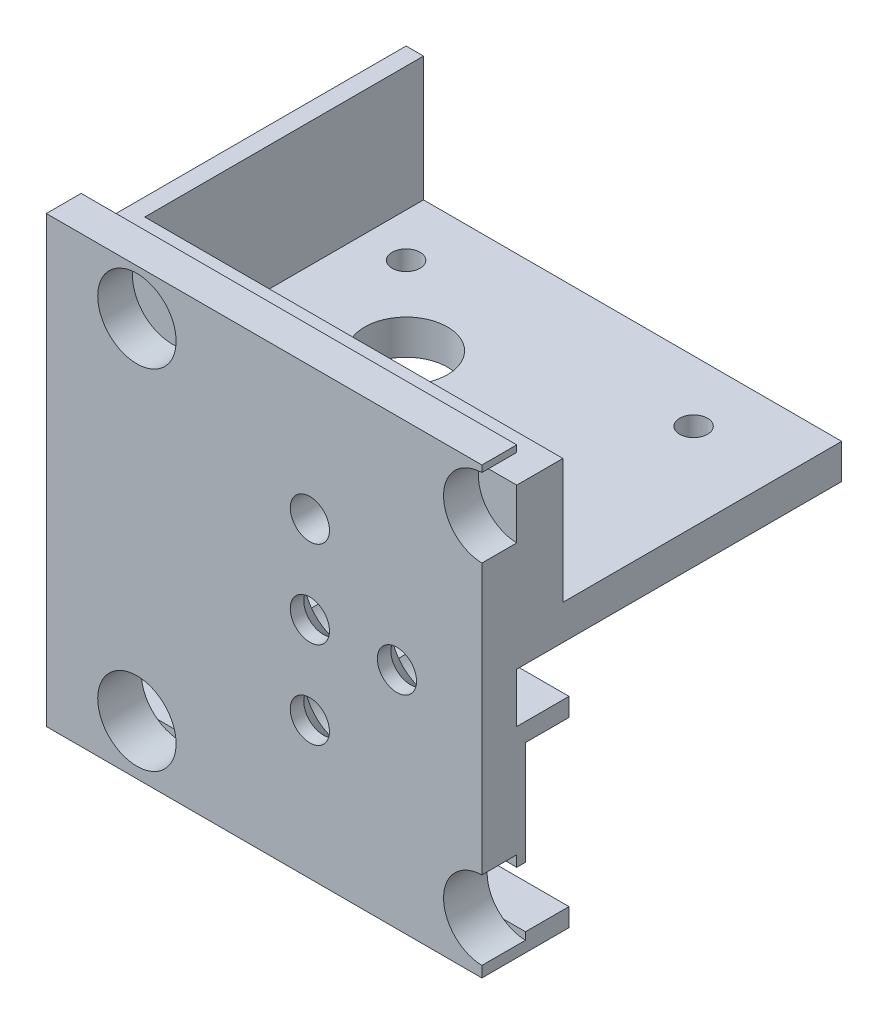
from build123d import *
from build123d.topology import SkipClean

# Parameters (mm, degrees)
BOSS_EXTRUDE1_START       = 0.5
SKETCH1_W                 = 25
SKETCH1_H                 = 14
BOSS_EXTRUDE1_DEPTH       = 2
SKETCH2_W                 = 25
SKETCH2_H                 = 2.1
BOSS_EXTRUDE2_DEPTH       = 6
SKETCH3_W                 = 50
SKETCH3_H                 = 42
BOSS_EXTRUDE3_DEPTH       = 4
BOSS_EXTRUDE5_START       = -18.3
SKETCH4_2_R               = 1.5
BOSS_EXTRUDE5_DEPTH       = 4
SKETCH5_W                 = 50
SKETCH5_H                 = 18.3
BOSS_EXTRUDE6_DEPTH       = 5.3
SKETCH24_W                = 50
SKETCH24_H                = 4
BOSS_EXTRUDE13_DEPTH      = 9
SKETCH7_R                 = 4.5
CUT_EXTRUDE1_DEPTH        = 4
SKETCH9_W                 = 35.343646405
SKETCH9_H                 = 8.813303651
CUT_EXTRUDE3_DEPTH        = 10
SKETCH11_R                = 12.5
SKETCH11_R_2              = 1.5
SKETCH11_R_3              = 3.55
BOSS_EXTRUDE7_DEPTH       = 4
SKETCH12_R                = 12.5
BOSS_EXTRUDE8_DEPTH       = 14
SKETCH13_W                = 25
SKETCH13_H                = 2.1
BOSS_EXTRUDE9_DEPTH       = 6
CUT_EXTRUDE2_DEPTH        = 64.84830294
SKETCH14_W                = 9.591087042
SKETCH14_H                = 22.957747356
CUT_EXTRUDE4_DEPTH        = 70.083614523
SKETCH15_W                = 33.975925545
SKETCH15_H                = 18.244219276
CUT_EXTRUDE5_DEPTH        = 62.391693358
SKETCH16_W                = 32
SKETCH16_H                = 4
BOSS_EXTRUDE10_DEPTH      = 50
SKETCH18_W                = 2
SKETCH18_H                = 14.3
BOSS_EXTRUDE11_DEPTH      = 32
CUT_EXTRUDE6_DEPTH        = 62.41738995
F_1_0MM_DOWEL_HOLE1_D     = 3.2
F_1_0MM_DOWEL_HOLE1_DEPTH = 33.03862301
F_1_0MM_DOWEL_HOLE1_TIP   = 0.96137699
BOSS_EXTRUDE12_DEPTH      = 1
CUT_EXTRUDE7_DEPTH        = 10
CHAMFER1_SIZE             = 2
CUT_EXTRUDE8_DEPTH        = 10
BOSS_EXTRUDE14_DEPTH      = 1
SKETCH26_W                = 50
SKETCH26_H                = 2.1
BOSS_EXTRUDE15_DEPTH      = 5


# Read off the part's stored shape, not the designer's step: CSK for M4 Flat Head Machine Screw1
with BuildPart() as part:
    # Sketch1 → Boss-Extrude1 (new body)
    with BuildSketch(Plane.XY.offset(-1).offset(BOSS_EXTRUDE1_START)):
        with Locations((23.192657344, 4)):
            Rectangle(SKETCH1_W, SKETCH1_H)
    extrude(amount=BOSS_EXTRUDE1_DEPTH)

    # Sketch2 → Boss-Extrude2 (add)
    with BuildSketch(Plane(origin=(0, 0, -0.5), x_dir=(-1, 0, 0), z_dir=(0, 0, -1))):
        with Locations((-23.192657344, 9.95)):
            Rectangle(SKETCH2_W, SKETCH2_H)
        with Locations((-23.192657344, -1.95)):
            Rectangle(SKETCH2_W, SKETCH2_H)
    extrude(amount=BOSS_EXTRUDE2_DEPTH)

    # Sketch3 → Boss-Extrude3 (add)
    with BuildSketch(Plane(origin=(0, 0, -0.5), x_dir=(-1, 0, 0), z_dir=(0, 0, -1))):
        with Locations((-10.692657344, 18)):
            Rectangle(SKETCH3_W, SKETCH3_H)
    extrude(amount=-BOSS_EXTRUDE3_DEPTH)

    # Sketch4<2> → Boss-Extrude5 (add)
    with BuildSketch(Plane(origin=(0, 35, 0), x_dir=(1, 0, 0), z_dir=(0, 1, 0)).offset(BOSS_EXTRUDE5_START)):
        with BuildLine():
            Line((-1.349302764, 24.5), (-1.349302764, 0.5))
            Line((-1.349302764, 0.5), (8.650697236, 0.5))
            Line((8.650697236, 0.5), (8.650697236, 24.5))
            ThreePointArc((8.650697236, 24.5), (3.650697236, 29.5), (-1.349302764, 24.5))
        make_face()
        with Locations(Location((3.650697236, 7.5, 0), (0, 0, 270))):
            Circle(SKETCH4_2_R, mode=Mode.SUBTRACT)
        with Locations(Location((3.650697236, 24.5, 0), (0, 0, 270))):
            Circle(SKETCH4_2_R, mode=Mode.SUBTRACT)
    extrude(amount=-BOSS_EXTRUDE5_DEPTH)

    # Sketch5 → Boss-Extrude6 (add)
    with BuildSketch(Plane(origin=(0, 0, -0.5), x_dir=(-1, 0, 0), z_dir=(0, 0, -1))):
        with Locations((-10.692657344, 25.85)):
            Rectangle(SKETCH5_W, SKETCH5_H)
    extrude(amount=BOSS_EXTRUDE6_DEPTH)

    # CSK for M4 Flat Head Machine Screw1 outl → CSK for M4 Flat Head Machine Screw1 (revolve, cut)
    with BuildSketch(Plane(origin=(15.942657344, 23.75, 0), x_dir=(1, 0, 0), z_dir=(0, -1, 0))):
        Polygon((2.25, -3.35), (2.25, 3.5), (0, 3.5), (0, -5.8), (4.7, -5.8), align=None)
    revolve(axis=Axis((15.942657344, 23.75, 0), (0, 0, 1)), mode=Mode.SUBTRACT)

    # CSK for M4 Flat Head Machine Screw1 2 ou → CSK for M4 Flat Head Machine Screw1 2 (revolve, cut)
    with BuildSketch(Plane(origin=(15.942657344, 3.75, 0), x_dir=(1, 0, 0), z_dir=(0, -1, 0))):
        Polygon((4.7, -0.5), (2.25, 1.95), (2.25, 3.5), (0, 3.5), (0, -0.5), align=None)
    revolve(axis=Axis((15.942657344, 3.75, 0), (0, 0, 1)), mode=Mode.SUBTRACT)

    # CSK for M4 Flat Head Machine Screw1 3 ou → CSK for M4 Flat Head Machine Screw1 3 (revolve, cut)
    with BuildSketch(Plane(origin=(15.942657344, 13.75, 0), x_dir=(1, 0, 0), z_dir=(0, -1, 0))):
        Polygon((4.7, -0.5), (2.25, 1.95), (2.25, 3.5), (0, 3.5), (0, -0.5), align=None)
    revolve(axis=Axis((15.942657344, 13.75, 0), (0, 0, 1)), mode=Mode.SUBTRACT)

    # CSK for M4 Flat Head Machine Screw1 4 ou → CSK for M4 Flat Head Machine Screw1 4 (revolve, cut)
    with BuildSketch(Plane(origin=(25.942657344, 13.75, 0), x_dir=(1, 0, 0), z_dir=(0, -1, 0))):
        Polygon((2.25, 1.95), (2.25, 3.5), (0, 3.5), (0, -0.5), (4.7, -0.5), align=None)
    revolve(axis=Axis((25.942657344, 13.75, 0), (0, 0, 1)), mode=Mode.SUBTRACT)

    # Sketch24 → Boss-Extrude13 (add)
    with BuildSketch(Plane.XZ.offset(3)):
        with Locations((10.692657344, 1.5)):
            Rectangle(SKETCH24_W, SKETCH24_H)
    extrude(amount=BOSS_EXTRUDE13_DEPTH)

    # Sketch7 → Cut-Extrude1 (cut)
    with BuildSketch(Plane(origin=(0, 0, 3.5), x_dir=(-1, 0, 0), z_dir=(0, 0, -1))):
        with Locations((-35.792657344, 33.75)):
            Circle(SKETCH7_R)
        with Locations(Location((3.907342656, 33.75, 0), (0, 0, 163.872379787))):
            Circle(SKETCH7_R)
        with Locations((3.907342656, -6.25)):
            Circle(SKETCH7_R)
        with Locations((-35.792657344, -6.25)):
            Circle(SKETCH7_R)
    extrude(amount=CUT_EXTRUDE1_DEPTH, mode=Mode.SUBTRACT)

    # Sketch9 → Cut-Extrude3 (cut)
    with BuildSketch(Plane.ZY.offset(1.349302764)):
        with Locations((-18.171823203, 12.293348175)):
            Rectangle(SKETCH9_W, SKETCH9_H)
    extrude(amount=-CUT_EXTRUDE3_DEPTH, mode=Mode.SUBTRACT)

    # Sketch11 → Boss-Extrude7 (add)
    # profile 1 of 4: a face of its own
    with BuildSketch(Plane.XZ.offset(-16.7)):
        with BuildLine():
            Line((-3.212467494, -5.8), (-14.307342656, -5.8))
            Line((-14.307342656, -5.8), (-14.807342656, -5.8))
            Line((-14.807342656, -5.8), (-14.807342656, -20.8))
            ThreePointArc((-14.807342656, -20.8), (-11.570691199, -11.320533638), (-3.212467494, -5.8))
        make_face()
    # profile 2 of 4: a face of its own
    with BuildSketch(Plane.XZ.offset(-16.7)):
        with BuildLine():
            Line((4.597782182, -5.8), (-3.212467494, -5.8))
            ThreePointArc((-3.212467494, -5.8), (-11.570691199, -11.320533638), (-14.807342656, -20.8))
            ThreePointArc((-14.807342656, -20.8), (0.692657344, -36.3), (16.192657344, -20.8))
            ThreePointArc((16.192657344, -20.8), (12.956005887, -11.320533638), (4.597782182, -5.8))
        make_face()
        with Locations((0.692657344, -20.8)):
            Circle(SKETCH11_R, mode=Mode.SUBTRACT)
    # profile 3 of 4: a face of its own
    with BuildSketch(Plane.XZ.offset(-16.7)):
        with Locations((0.692657344, -20.8)):
            Circle(SKETCH11_R)
        with Locations(Location((0.692657344, -12.3, 0), (0, 0, 270))):
            Circle(SKETCH11_R_2, mode=Mode.SUBTRACT)
        with Locations(Location((0.692657344, -20.8, 0), (0, 0, 270))):
            Circle(SKETCH11_R_3, mode=Mode.SUBTRACT)
        with Locations(Location((9.192657344, -20.8, 0), (0, 0, 270))):
            Circle(SKETCH11_R_2, mode=Mode.SUBTRACT)
        with Locations(Location((0.692657344, -29.3, 0), (0, 0, 270))):
            Circle(SKETCH11_R_2, mode=Mode.SUBTRACT)
        with Locations(Location((-7.807342656, -20.8, 0), (0, 0, 270))):
            Circle(SKETCH11_R_2, mode=Mode.SUBTRACT)
    # profile 4 of 4: a face of its own
    with BuildSketch(Plane.XZ.offset(-16.7)):
        with BuildLine():
            Line((16.192657344, -5.8), (4.597782182, -5.8))
            ThreePointArc((4.597782182, -5.8), (12.956005887, -11.320533638), (16.192657344, -20.8))
            Line((16.192657344, -20.8), (16.192657344, -5.8))
        make_face()
    extrude(amount=-BOSS_EXTRUDE7_DEPTH)

    # Sketch12 → Boss-Extrude8 (add)
    with SkipClean():  # the faces are left unmerged after this step: merging them gives an invalid solid
        with BuildSketch(Plane(origin=(0, 20.7, 0), x_dir=(1, 0, 0), z_dir=(0, 1, 0))):
            with BuildLine():
                Line((-14.807342656, 20.8), (-14.807342656, 5.8))
                Line((-14.807342656, 5.8), (16.192657344, 5.8))
                Line((16.192657344, 5.8), (16.192657344, 20.8))
                ThreePointArc((16.192657344, 20.8), (0.692657344, 36.3), (-14.807342656, 20.8))
            make_face()
            with Locations(Location((0.692657344, 20.8, 0), (0, 0, 270))):
                Circle(SKETCH12_R, mode=Mode.SUBTRACT)
        extrude(amount=BOSS_EXTRUDE8_DEPTH)

    # Sketch13 → Boss-Extrude9 (add)
    with SkipClean():  # the faces are left unmerged after this step: merging them gives an invalid solid
        with BuildSketch(Plane(origin=(0, 0, -0.5), x_dir=(-1, 0, 0), z_dir=(0, 0, -1))):
            with Locations((1.807342656, 9.95)):
                Rectangle(SKETCH13_W, SKETCH13_H)
            with Locations((1.807342656, -1.95)):
                Rectangle(SKETCH13_W, SKETCH13_H)
        extrude(amount=BOSS_EXTRUDE9_DEPTH)

    # Sketch8 → Cut-Extrude2 (cut, through all)
    with SkipClean():  # the faces are left unmerged after this step: merging them gives an invalid solid
        with BuildSketch(Plane(origin=(0, 0, -0.5), x_dir=(-1, 0, 0), z_dir=(0, 0, -1))):
            with BuildLine():
                ThreePointArc((-12.283764069, 16.7), (-15.942657344, 18.45), (-19.601550619, 16.7))
                ThreePointArc((-19.601550619, 16.7), (-20.640973864, 13.875785056), (-19.754153113, 11))
                ThreePointArc((-19.754153113, 11), (-15.942657344, 9.05), (-12.131161575, 11))
                ThreePointArc((-12.131161575, 11), (-11.244340824, 13.875785056), (-12.283764069, 16.7))
            make_face()
            with BuildLine():
                ThreePointArc((-22.283764069, 16.7), (-25.942657344, 18.45), (-29.601550619, 16.7))
                ThreePointArc((-29.601550619, 16.7), (-30.640973864, 13.875785056), (-29.754153113, 11))
                ThreePointArc((-29.754153113, 11), (-25.942657344, 9.05), (-22.131161575, 11))
                ThreePointArc((-22.131161575, 11), (-21.244340824, 13.875785056), (-22.283764069, 16.7))
            make_face()
        extrude(amount=CUT_EXTRUDE2_DEPTH, mode=Mode.SUBTRACT)

    # Sketch14 → Cut-Extrude4 (cut, through all)
    with SkipClean():  # the faces are left unmerged after this step: merging them gives an invalid solid
        with BuildSketch(Plane(origin=(0, 34.7, 0), x_dir=(1, 0, 0), z_dir=(0, 1, 0))):
            with Locations((-19.102886177, 17.278873678)):
                Rectangle(SKETCH14_W, SKETCH14_H)
        extrude(amount=-CUT_EXTRUDE4_DEPTH, mode=Mode.SUBTRACT)

    # Sketch15 → Cut-Extrude5 (cut, through all)
    with BuildSketch(Plane(origin=(16.192657344, 0, 0), x_dir=(0, 0, -1), z_dir=(1, 0, 0))):
        with Locations((22.787962773, 25.822109638)):
            Rectangle(SKETCH15_W, SKETCH15_H)
    extrude(amount=-CUT_EXTRUDE5_DEPTH, mode=Mode.SUBTRACT)

    # Sketch16 → Boss-Extrude10 (add, through all)
    with BuildSketch(Plane.ZY.offset(14.307342656)):
        with Locations((-21.8, 18.7)):
            Rectangle(SKETCH16_W, SKETCH16_H)
    extrude(amount=-BOSS_EXTRUDE10_DEPTH)

    # Sketch18 → Boss-Extrude11 (add, through all)
    with BuildSketch(Plane(origin=(0, 0, -5.8), x_dir=(-1, 0, 0), z_dir=(0, 0, -1))):
        with Locations((13.307342656, 27.85)):
            Rectangle(SKETCH18_W, SKETCH18_H)
    extrude(amount=BOSS_EXTRUDE11_DEPTH)

    # Sketch19 → Cut-Extrude6 (cut, through all)
    with BuildSketch(Plane(origin=(0, 20.7, 0), x_dir=(1, 0, 0), z_dir=(0, 1, 0))):
        with BuildLine():
            ThreePointArc((3.376188065, 17.358353423), (6.134303921, 23.483530721), (0.009126623, 26.241646577))
            ThreePointArc((0.009126623, 26.241646577), (-2.748989233, 20.116469279), (3.376188065, 17.358353423))
        make_face()
    extrude(amount=-CUT_EXTRUDE6_DEPTH, mode=Mode.SUBTRACT)

    # Ø1.0mm Dowel Hole1
    with Locations(Plane(origin=(-7.307342656, 20.7, -30.8), x_dir=(0, 0, 1), z_dir=(0, 1, 0))):
        with Locations((0, 0), (18, 0), (18, 33), (0, 33)):
            Hole(F_1_0MM_DOWEL_HOLE1_D / 2, depth=F_1_0MM_DOWEL_HOLE1_DEPTH)
            with Locations((0, 0, -(F_1_0MM_DOWEL_HOLE1_DEPTH + F_1_0MM_DOWEL_HOLE1_TIP / 2))):  # 118° drill point
                Cone(0, F_1_0MM_DOWEL_HOLE1_D / 2, F_1_0MM_DOWEL_HOLE1_TIP, mode=Mode.SUBTRACT)

    # Sketch21 → Boss-Extrude12 (add)
    with BuildSketch(Plane(origin=(0, 0, -0.5), x_dir=(-1, 0, 0), z_dir=(0, 0, -1))):
        with BuildLine():
            Line((-15.258917627, -0.9), (14.307342656, -0.9))
            Line((14.307342656, -0.9), (14.307342656, 8.9))
            Line((14.307342656, 8.9), (-35.692657344, 8.9))
            Line((-35.692657344, 8.9), (-35.692657344, -0.9))
            Line((-35.692657344, -0.9), (-16.626397061, -0.9))
            ThreePointArc((-16.626397061, -0.9), (-15.942657344, 8.45), (-15.258917627, -0.9))
        make_face()
    extrude(amount=BOSS_EXTRUDE12_DEPTH)

    # Sketch22 → Cut-Extrude7 (cut)
    with BuildSketch(Plane(origin=(0, 0, -5.8), x_dir=(-1, 0, 0), z_dir=(0, 0, -1))):
        with BuildLine():
            ThreePointArc((-22.283764069, 16.7), (-25.942657344, 18.45), (-29.601550619, 16.7))
            ThreePointArc((-29.601550619, 16.7), (-30.640973864, 13.875785056), (-29.754153113, 11))
            ThreePointArc((-29.754153113, 11), (-25.942657344, 9.05), (-22.131161575, 11))
            ThreePointArc((-22.131161575, 11), (-21.244340824, 13.875785056), (-22.283764069, 16.7))
        make_face()
        with BuildLine():
            ThreePointArc((-12.283764069, 16.7), (-15.942657344, 18.45), (-19.601550619, 16.7))
            ThreePointArc((-19.601550619, 16.7), (-20.640973864, 13.875785056), (-19.754153113, 11))
            ThreePointArc((-19.754153113, 11), (-15.942657344, 9.05), (-12.131161575, 11))
            ThreePointArc((-12.131161575, 11), (-11.244340824, 13.875785056), (-12.283764069, 16.7))
        make_face()
        with BuildLine():
            ThreePointArc((-19.518618753, 20.7), (-15.942657344, 19.05), (-12.366695935, 20.7))
            ThreePointArc((-12.366695935, 20.7), (-15.942657344, 28.45), (-19.518618753, 20.7))
        make_face()
    extrude(amount=CUT_EXTRUDE7_DEPTH, mode=Mode.SUBTRACT)

    # Chamfer1
    # the kernel refuses this chamfer: 2 mm, written as the material it takes off along each edge
    with BuildSketch(Plane(origin=(7.223329959, 20.7, -15.8), x_dir=(0, -0.9996219169112968, 0.02749587661058651), z_dir=(1, 0, 0))) as chamfer1_piece_1_section:
        Polygon((CHAMFER1_SIZE * 0.999621916911, CHAMFER1_SIZE * 0.0274958766106), (-CHAMFER1_SIZE * 0.0274958766106, CHAMFER1_SIZE * 0.999621916911), (0, 0), align=None)
    chamfer1_piece_1 = extrude(amount=17.43865477, mode=Mode.PRIVATE)
    chamfer1_piece_1 = chamfer1_piece_1 & Plane(origin=(15.942657344, 23.75, -16.543684423), x_dir=(0.7608428530186694, -0.6489361702127657, 0), z_dir=(0, 0, 1)) * Cylinder(4.7, 43, mode=Mode.PRIVATE)
    add(chamfer1_piece_1, mode=Mode.SUBTRACT)
    with BuildSketch(Plane(origin=(24.744916595, 16.7, -15.8), x_dir=(0, 0.9996219169112968, 0.02749587661058651), z_dir=(-1, 0, 0))) as chamfer1_piece_2_section:
        Polygon((CHAMFER1_SIZE * 0.999621916911, CHAMFER1_SIZE * 0.0274958766106), (-CHAMFER1_SIZE * 0.0274958766106, CHAMFER1_SIZE * 0.999621916911), (0, 0), align=None)
    chamfer1_piece_2 = extrude(amount=17.604518502, mode=Mode.PRIVATE)
    chamfer1_piece_2 = chamfer1_piece_2 & Plane(origin=(25.942657344, 13.75, -16.56864212), x_dir=(-0.8109565466765494, -0.5851063829787245, 0), z_dir=(0, 0, 1)) * Cylinder(4.7, 44, mode=Mode.PRIVATE)
    add(chamfer1_piece_2, mode=Mode.SUBTRACT)
    with BuildSketch(Plane(origin=(24.744916595, 16.7, -15.8), x_dir=(0, 0.9996219169112968, 0.02749587661058651), z_dir=(-1, 0, 0))) as chamfer1_piece_3_section:
        Polygon((CHAMFER1_SIZE * 0.999621916911, CHAMFER1_SIZE * 0.0274958766106), (-CHAMFER1_SIZE * 0.0274958766106, CHAMFER1_SIZE * 0.999621916911), (0, 0), align=None)
    chamfer1_piece_3 = extrude(amount=17.604518502, mode=Mode.PRIVATE)
    chamfer1_piece_3 = chamfer1_piece_3 & Plane(origin=(15.942657344, 13.75, -16.53312589), x_dir=(-0.7784879309138604, 0.6276595744680842, 0), z_dir=(0, 0, 1)) * Cylinder(4.7, 44, mode=Mode.PRIVATE)
    add(chamfer1_piece_3, mode=Mode.SUBTRACT)
    with BuildSketch(Plane(origin=(34.744916595, 16.7, -15.8), x_dir=(0, 0.9996219169112968, 0.02749587661058651), z_dir=(-1, 0, 0))) as chamfer1_piece_4_section:
        Polygon((CHAMFER1_SIZE * 0.999621916911, CHAMFER1_SIZE * 0.0274958766106), (-CHAMFER1_SIZE * 0.0274958766106, CHAMFER1_SIZE * 0.999621916911), (0, 0), align=None)
    chamfer1_piece_4 = extrude(amount=17.604518502, mode=Mode.PRIVATE)
    chamfer1_piece_4 = chamfer1_piece_4 & Plane(origin=(25.942657344, 13.75, -16.533125893), x_dir=(-0.8109565466765494, -0.5851063829787245, 0), z_dir=(0, 0, 1)) * Cylinder(4.7, 44, mode=Mode.PRIVATE)
    add(chamfer1_piece_4, mode=Mode.SUBTRACT)
    with BuildSketch(Plane(origin=(34.744916595, 16.7, -15.8), x_dir=(0, 0.9996219169112968, 0.02749587661058651), z_dir=(-1, 0, 0))) as chamfer1_piece_5_section:
        Polygon((CHAMFER1_SIZE * 0.999621916911, CHAMFER1_SIZE * 0.0274958766106), (-CHAMFER1_SIZE * 0.0274958766106, CHAMFER1_SIZE * 0.999621916911), (0, 0), align=None)
    chamfer1_piece_5 = extrude(amount=17.604518502, mode=Mode.PRIVATE)
    chamfer1_piece_5 = chamfer1_piece_5 & Plane(origin=(15.942657344, 13.75, -16.568642119), x_dir=(-0.7784879309138604, 0.6276595744680842, 0), z_dir=(0, 0, 1)) * Cylinder(4.7, 44, mode=Mode.PRIVATE)
    add(chamfer1_piece_5, mode=Mode.SUBTRACT)

    # Sketch23 → Cut-Extrude8 (cut)
    with BuildSketch(Plane.XZ.offset(3)):
        Polygon((35.692657344, -1.5), (16.626397061, -1.5), (15.258917627, -1.5), (-14.307342656, -1.5), (-14.307342656, -6.5), (35.692657344, -6.5), align=None)
    extrude(amount=-CUT_EXTRUDE8_DEPTH, mode=Mode.SUBTRACT)

    # Sketch25 → Boss-Extrude14 (add)
    with BuildSketch(Plane(origin=(0, 0, -0.5), x_dir=(-1, 0, 0), z_dir=(0, 0, -1))):
        with BuildLine():
            Line((0.794867757, -3), (-32.680182444, -3))
            ThreePointArc((-32.680182444, -3), (-31.598456828, -7.880546544), (-35.692657344, -10.748888752))
            Line((-35.692657344, -10.748888752), (-35.692657344, -12))
            Line((-35.692657344, -12), (14.307342656, -12))
            Line((14.307342656, -12), (14.307342656, -3))
            Line((14.307342656, -3), (7.019817556, -3))
            ThreePointArc((7.019817556, -3), (3.907342656, -10.75), (0.794867757, -3))
        make_face()
    extrude(amount=BOSS_EXTRUDE14_DEPTH)

    # Sketch26 → Boss-Extrude15 (add)
    with BuildSketch(Plane(origin=(0, 0, -1.5), x_dir=(-1, 0, 0), z_dir=(0, 0, -1))):
        with Locations((-10.692657344, -10.95)):
            Rectangle(SKETCH26_W, SKETCH26_H)
    extrude(amount=BOSS_EXTRUDE15_DEPTH)


solid = part.part
